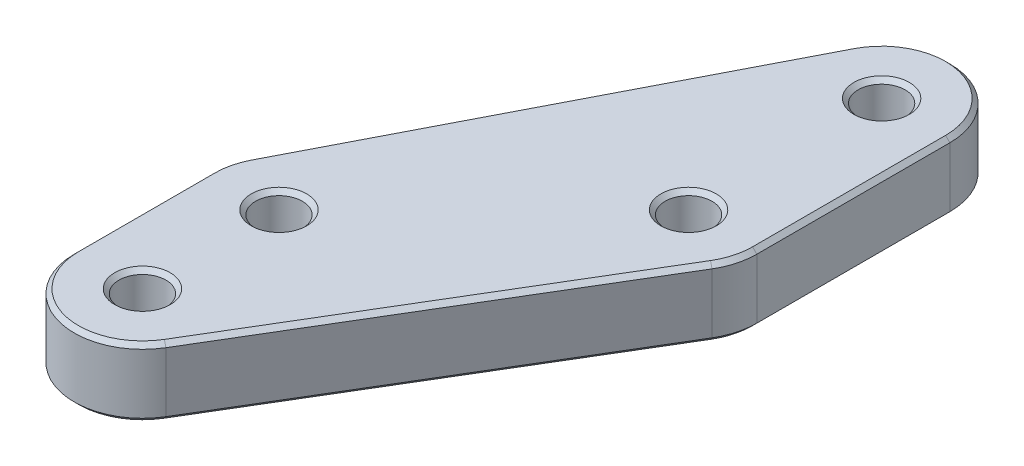
from build123d import *

# Parameters (mm, degrees)
SKETCH1_R           = 2.1828125
BOSS_EXTRUDE1_DEPTH = 3.175
CHAMFER1_SIZE       = 0.396875


with BuildPart() as part:
    # Sketch1 → Boss-Extrude1 (new, symmetric)
    with BuildSketch(Plane(origin=(0, 0, 0), x_dir=(1, 0, 0), z_dir=(0, 1, 0))):
        with BuildLine():
            Line((-25.4, -19.05), (-25.4, -31.75))
            ThreePointArc((-25.4, -31.75), (-20.745028245, -37.869589794), (-13.604919922, -35.017048047))
            Line((-13.604919922, -35.017048047), (5.445080078, -3.267048047))
            ThreePointArc((5.445080078, -3.267048047), (6.119589794, -1.695028245), (6.35, 0))
            Line((6.35, 0), (6.35, 17.9578))
            ThreePointArc((6.35, 17.9578), (1.495168473, 24.12926427), (-5.645896452, 20.864061043))
            Line((-5.645896452, 20.864061043), (-24.695896452, -16.143738957))
            ThreePointArc((-24.695896452, -16.143738957), (-25.22146427, -17.554831527), (-25.4, -19.05))
        make_face()
        Circle(SKETCH1_R, mode=Mode.SUBTRACT)
        with Locations((0, 17.9578)):
            Circle(SKETCH1_R, mode=Mode.SUBTRACT)
        with Locations((-19.05, -19.05)):
            Circle(SKETCH1_R, mode=Mode.SUBTRACT)
        with Locations((-19.05, -31.75)):
            Circle(SKETCH1_R, mode=Mode.SUBTRACT)
    extrude(amount=BOSS_EXTRUDE1_DEPTH, both=True)

    # Chamfer1
    chamfer1_edges = [part.edges().sort_by_distance(p)[0] for p in [
        (-21.2328125, -3.175, 31.75),
        (-21.2328125, -3.175, 19.05),
        (-2.1828125, -3.175, -17.9578),
        (-2.1828125, -3.175, 0),
        (-25.4, -3.175, 25.4),
        (-20.745028245, -3.175, 37.869589794),
        (-4.079919922, -3.175, 19.142048047),
        (6.119589794, -3.175, 1.695028245),
        (6.35, -3.175, -8.9789),
        (1.495168473, -3.175, -24.12926427),
        (-15.170896452, -3.175, -2.360161043),
        (-25.22146427, -3.175, 17.554831527),
        (-21.2328125, 3.175, 31.75),
        (-2.1828125, 3.175, -17.9578),
        (-15.170896452, 3.175, -2.360161043),
        (1.495168473, 3.175, -24.12926427),
        (6.35, 3.175, -8.9789),
        (6.119589794, 3.175, 1.695028245),
        (-4.079919922, 3.175, 19.142048047),
        (-20.745028245, 3.175, 37.869589794),
        (-25.4, 3.175, 25.4),
        (-25.22146427, 3.175, 17.554831527),
        (-2.1828125, 3.175, 0),
        (-21.2328125, 3.175, 19.05),
    ]]
    chamfer(chamfer1_edges, length=CHAMFER1_SIZE)


solid = part.part
